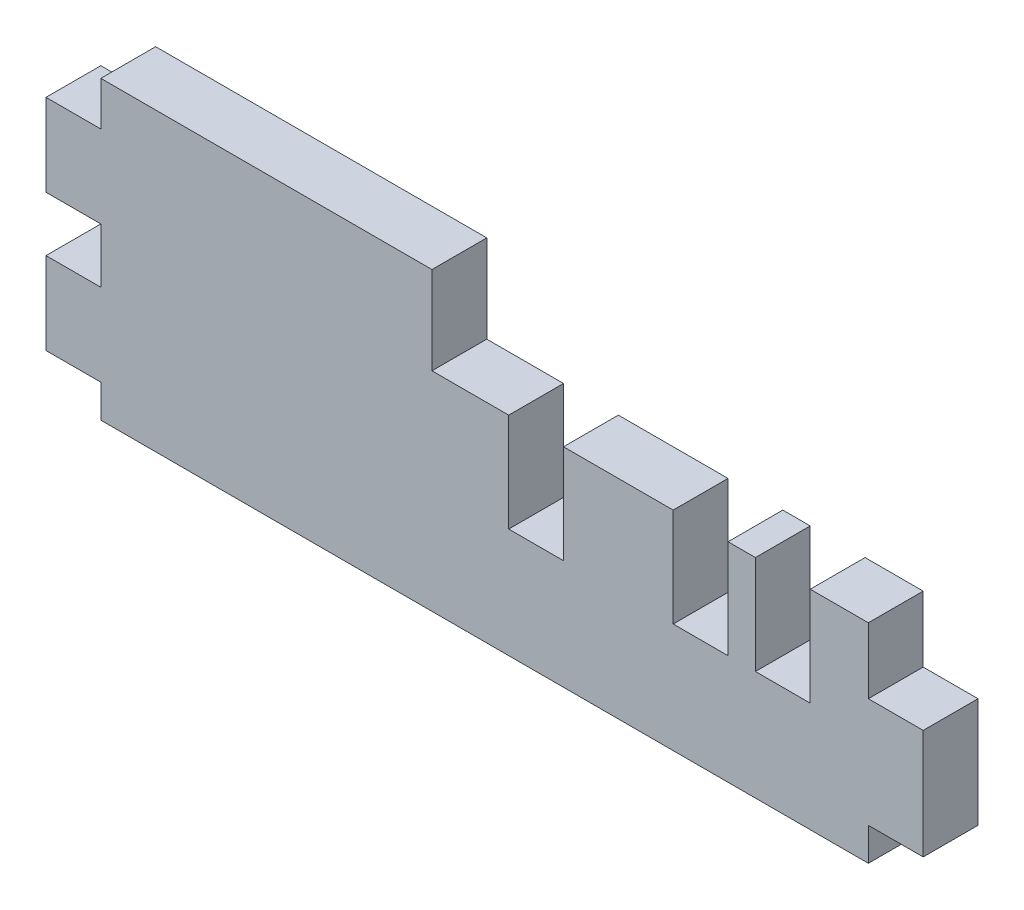
from build123d import *

# Parameters (mm, degrees)
BOSS_EXTRU_1_DEPTH = 5


with BuildPart() as part:
    # Esquisse1 → Boss.-Extru.1 (new body)
    with BuildSketch(Plane.XY):
        Polygon((-5, 0), (0, 0), (0, -3), (70, -3), (70, 0), (75, 0), (75, 10), (70, 10), (70, 16), (64.7, 16), (64.7, 7), (59.7, 7), (59.7, 16), (57.2, 16), (57.2, 7), (52.2, 7), (52.2, 16), (42.2, 16), (42.2, 7), (37.2, 7), (37.2, 16), (30.2, 16), (30.2, 24), (0, 24), (0, 20), (-5, 20), (-5, 12.5), (0, 12.5), (0, 7.5), (-5, 7.5), align=None)
    extrude(amount=BOSS_EXTRU_1_DEPTH)


solid = part.part
